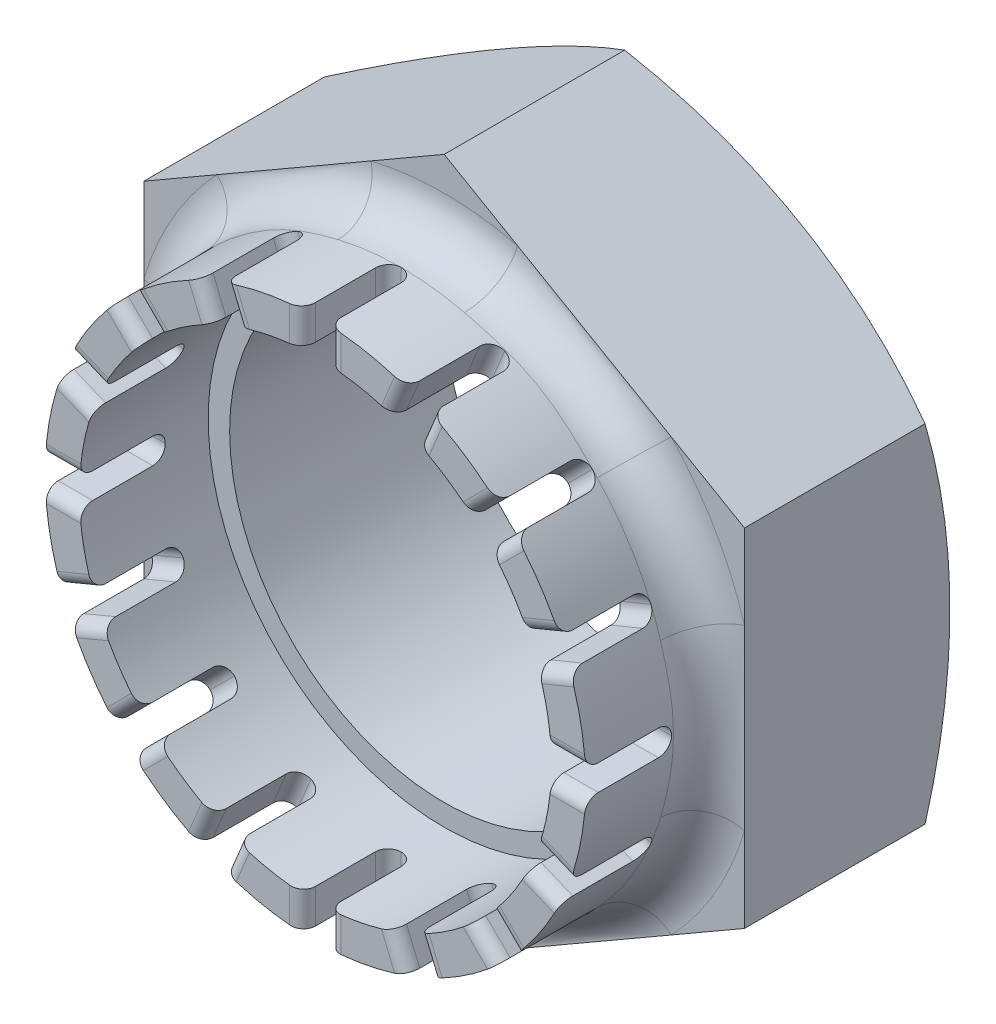
from build123d import *
from build123d.topology import SkipClean

# Parameters (mm, degrees)
SKETCH1_R           = 25
BOSS_EXTRUDE1_DEPTH = 25
SKETCH2_R           = 31.5
SKETCH2_R_2         = 27.5
BOSS_EXTRUDE2_DEPTH = 15
FILLET3_R           = 5
SKETCH5_W           = 3
SKETCH5_H           = 23.637498
CUT_EXTRUDE1_DEPTH  = 10
FILLET4_R           = 1.5
CIRPATTERN1_START   = -31.5
CIRPATTERN1_DEPTH   = 4.164126
CIRPATTERN1_2_DEPTH = 63
CIRPATTERN1_3_DEPTH = 63
CIRPATTERN1_4_DEPTH = 63
CIRPATTERN1_5_DEPTH = 63
CIRPATTERN1_6_DEPTH = 63
CIRPATTERN1_7_DEPTH = 63
CIRPATTERN1_8_DEPTH = 63


# Read off the part's stored shape, not the designer's step: CirPattern1
with BuildPart() as part:
    # Sketch1 → Boss-Extrude1 (new body)
    with BuildSketch(Plane.XY):
        Polygon((0, -40.414519), (35, -20.207259), (35, 20.207259), (0, 40.414519), (-35, 20.207259), (-35, -20.207259), align=None)
        Circle(SKETCH1_R, mode=Mode.SUBTRACT)
    extrude(amount=BOSS_EXTRUDE1_DEPTH)

    # Sketch2 → Boss-Extrude2 (add)
    with BuildSketch(Plane.XY.offset(25)):
        Circle(SKETCH2_R)
        Circle(SKETCH2_R_2, mode=Mode.SUBTRACT)
    extrude(amount=BOSS_EXTRUDE2_DEPTH)

    # Sketch3 → Cut-Revolve2 (revolve, cut)
    with SkipClean():  # the faces are left unmerged after this step: merging them gives an invalid solid
        with BuildSketch(Plane(origin=(0, 0, 0), x_dir=(1, 0, 0), z_dir=(0, 1, 0))):
            with BuildLine():
                Line((-62.420035, -22.962621), (-40.877833, 12.723646))
                Line((-40.877833, 12.723646), (83.571996, 8.624999))
                Line((83.571996, 8.624999), (59.385152, -19.395861))
                ThreePointArc((59.385152, -19.395861), (-2.341596, 6.965723), (-62.420035, -22.962621))
            make_face()
        revolve(axis=Axis((0, 0, 73), (-1, 0, 0)), mode=Mode.SUBTRACT)

    # Fillet3
    fillet3_edges = [part.edges().sort_by_distance(p)[0] for p in [
        (-31.5, 0, 25),
    ]]
    fillet(fillet3_edges, radius=FILLET3_R)

    # Sketch5 → Cut-Extrude1 (cut)
    with SkipClean():  # the faces are left unmerged after this step: merging them gives an invalid solid
        with BuildSketch(Plane.XY.offset(40)):
            with Locations((0, 29.812462)):
                Rectangle(SKETCH5_W, SKETCH5_H)
        extrude(amount=-CUT_EXTRUDE1_DEPTH, mode=Mode.SUBTRACT)

    # Fillet4
    fillet4_edges = [part.edges().sort_by_distance(p)[0] for p in [
        (1.5, 29.461663, 30),
        (-1.5, 29.461663, 30),
    ]]
    fillet(fillet4_edges, radius=FILLET4_R - 0.0004)  # a hair under: the kernel refuses the full size
    fillet4_2_edges = [part.edges().sort_by_distance(p)[0] for p in [
        (1.5, 29.461663, 40),
        (-1.5, 29.461663, 40),
    ]]
    fillet(fillet4_2_edges, radius=FILLET4_R)

    # CirPattern1 outline → CirPattern1 (cut)
    with SkipClean():  # the faces are left unmerged after this step: merging them gives an invalid solid
        with BuildSketch(Plane(origin=(0, 0, 0), x_dir=(1, 0, 0), z_dir=(0, 1, 0)).offset(CIRPATTERN1_START)):
            with BuildLine():
                ThreePointArc((0, -30), (-1.06066, -30.43934), (-1.5, -31.5))
                Line((-1.5, -31.5), (-1.5, -38.5))
                ThreePointArc((-1.5, -38.5), (-1.93934, -39.56066), (-3, -40))
                Line((-3, -40), (3, -40))
                ThreePointArc((3, -40), (1.93934, -39.56066), (1.5, -38.5))
                Line((1.5, -38.5), (1.5, -31.5))
                ThreePointArc((1.5, -31.5), (1.06066, -30.43934), (0, -30))
            make_face()
        extrude(amount=CIRPATTERN1_DEPTH, mode=Mode.SUBTRACT)

    # CirPattern1 2 outline → CirPattern1 2 (cut)
    with SkipClean():  # the faces are left unmerged after this step: merging them gives an invalid solid
        with BuildSketch(Plane(origin=(0, 0, 0), x_dir=(0.9238795325112863, -0.38268343236509084, 0), z_dir=(0.3826834323650908, 0.9238795325112864, 0)).offset(CIRPATTERN1_START)):
            with BuildLine():
                ThreePointArc((0, -30), (-1.06066, -30.43934), (-1.5, -31.5))
                Line((-1.5, -31.5), (-1.5, -38.5))
                ThreePointArc((-1.5, -38.5), (-1.93934, -39.56066), (-3, -40))
                Line((-3, -40), (3, -40))
                ThreePointArc((3, -40), (1.93934, -39.56066), (1.5, -38.5))
                Line((1.5, -38.5), (1.5, -31.5))
                ThreePointArc((1.5, -31.5), (1.06066, -30.43934), (0, -30))
            make_face()
        extrude(amount=CIRPATTERN1_2_DEPTH, mode=Mode.SUBTRACT)

    # CirPattern1 3 outline → CirPattern1 3 (cut)
    with SkipClean():  # the faces are left unmerged after this step: merging them gives an invalid solid
        with BuildSketch(Plane(origin=(0, 0, 0), x_dir=(0.707106781186546, -0.707106781186549, 0), z_dir=(0.707106781186549, 0.707106781186546, 0)).offset(CIRPATTERN1_START)):
            with BuildLine():
                ThreePointArc((0, -30), (-1.06066, -30.43934), (-1.5, -31.5))
                Line((-1.5, -31.5), (-1.5, -38.5))
                ThreePointArc((-1.5, -38.5), (-1.93934, -39.56066), (-3, -40))
                Line((-3, -40), (3, -40))
                ThreePointArc((3, -40), (1.93934, -39.56066), (1.5, -38.5))
                Line((1.5, -38.5), (1.5, -31.5))
                ThreePointArc((1.5, -31.5), (1.06066, -30.43934), (0, -30))
            make_face()
        extrude(amount=CIRPATTERN1_3_DEPTH, mode=Mode.SUBTRACT)

    # CirPattern1 4 outline → CirPattern1 4 (cut)
    with SkipClean():  # the faces are left unmerged after this step: merging them gives an invalid solid
        with BuildSketch(Plane(origin=(0, 0, 0), x_dir=(-0.3826834323650879, 0.9238795325112875, 0), z_dir=(0.9238795325112876, 0.3826834323650879, 0)).offset(CIRPATTERN1_START)):
            with BuildLine():
                ThreePointArc((0, 30), (1.06066, 30.43934), (1.5, 31.5))
                Line((1.5, 31.5), (1.5, 38.5))
                ThreePointArc((1.5, 38.5), (1.93934, 39.56066), (3, 40))
                Line((3, 40), (-3, 40))
                ThreePointArc((-3, 40), (-1.93934, 39.56066), (-1.5, 38.5))
                Line((-1.5, 38.5), (-1.5, 31.5))
                ThreePointArc((-1.5, 31.5), (-1.06066, 30.43934), (0, 30))
            make_face()
        extrude(amount=CIRPATTERN1_4_DEPTH, mode=Mode.SUBTRACT)

    # CirPattern1 5 outline → CirPattern1 5 (cut)
    with SkipClean():  # the faces are left unmerged after this step: merging them gives an invalid solid
        with BuildSketch(Plane.YZ.offset(CIRPATTERN1_START)):
            with BuildLine():
                ThreePointArc((0, 30), (1.06066, 30.43934), (1.5, 31.5))
                Line((1.5, 31.5), (1.5, 38.5))
                ThreePointArc((1.5, 38.5), (1.93934, 39.56066), (3, 40))
                Line((3, 40), (-3, 40))
                ThreePointArc((-3, 40), (-1.93934, 39.56066), (-1.5, 38.5))
                Line((-1.5, 38.5), (-1.5, 31.5))
                ThreePointArc((-1.5, 31.5), (-1.06066, 30.43934), (0, 30))
            make_face()
        extrude(amount=CIRPATTERN1_5_DEPTH, mode=Mode.SUBTRACT)

    # CirPattern1 6 outline → CirPattern1 6 (cut)
    with SkipClean():  # the faces are left unmerged after this step: merging them gives an invalid solid
        with BuildSketch(Plane(origin=(0, 0, 0), x_dir=(0.3826834323650941, 0.9238795325112851, 0), z_dir=(0.9238795325112851, -0.38268343236509406, 0)).offset(CIRPATTERN1_START)):
            with BuildLine():
                ThreePointArc((0, 30), (1.06066, 30.43934), (1.5, 31.5))
                Line((1.5, 31.5), (1.5, 38.5))
                ThreePointArc((1.5, 38.5), (1.93934, 39.56066), (3, 40))
                Line((3, 40), (-3, 40))
                ThreePointArc((-3, 40), (-1.93934, 39.56066), (-1.5, 38.5))
                Line((-1.5, 38.5), (-1.5, 31.5))
                ThreePointArc((-1.5, 31.5), (-1.06066, 30.43934), (0, 30))
            make_face()
        extrude(amount=CIRPATTERN1_6_DEPTH, mode=Mode.SUBTRACT)

    # CirPattern1 7 outline → CirPattern1 7 (cut)
    with SkipClean():  # the faces are left unmerged after this step: merging them gives an invalid solid
        with BuildSketch(Plane(origin=(0, 0, 0), x_dir=(0.7071067811865509, 0.707106781186544, 0), z_dir=(0.707106781186544, -0.707106781186551, 0)).offset(CIRPATTERN1_START)):
            with BuildLine():
                ThreePointArc((-3, 40), (-1.93934, 39.56066), (-1.5, 38.5))
                Line((-1.5, 38.5), (-1.5, 31.5))
                ThreePointArc((-1.5, 31.5), (-1.06066, 30.43934), (0, 30))
                ThreePointArc((0, 30), (1.06066, 30.43934), (1.5, 31.5))
                Line((1.5, 31.5), (1.5, 38.5))
                ThreePointArc((1.5, 38.5), (1.93934, 39.56066), (3, 40))
                Line((3, 40), (-3, 40))
            make_face()
        extrude(amount=CIRPATTERN1_7_DEPTH, mode=Mode.SUBTRACT)

    # CirPattern1 8 outline → CirPattern1 8 (cut)
    with SkipClean():  # the faces are left unmerged after this step: merging them gives an invalid solid
        with BuildSketch(Plane(origin=(0, 0, 0), x_dir=(0.9238795325112891, 0.3826834323650842, 0), z_dir=(0.3826834323650841, -0.9238795325112892, 0)).offset(CIRPATTERN1_START)):
            with BuildLine():
                ThreePointArc((0, 30), (1.06066, 30.43934), (1.5, 31.5))
                Line((1.5, 31.5), (1.5, 38.5))
                ThreePointArc((1.5, 38.5), (1.93934, 39.56066), (3, 40))
                Line((3, 40), (-3, 40))
                ThreePointArc((-3, 40), (-1.93934, 39.56066), (-1.5, 38.5))
                Line((-1.5, 38.5), (-1.5, 31.5))
                ThreePointArc((-1.5, 31.5), (-1.06066, 30.43934), (0, 30))
            make_face()
        extrude(amount=CIRPATTERN1_8_DEPTH, mode=Mode.SUBTRACT)


solid = part.part
